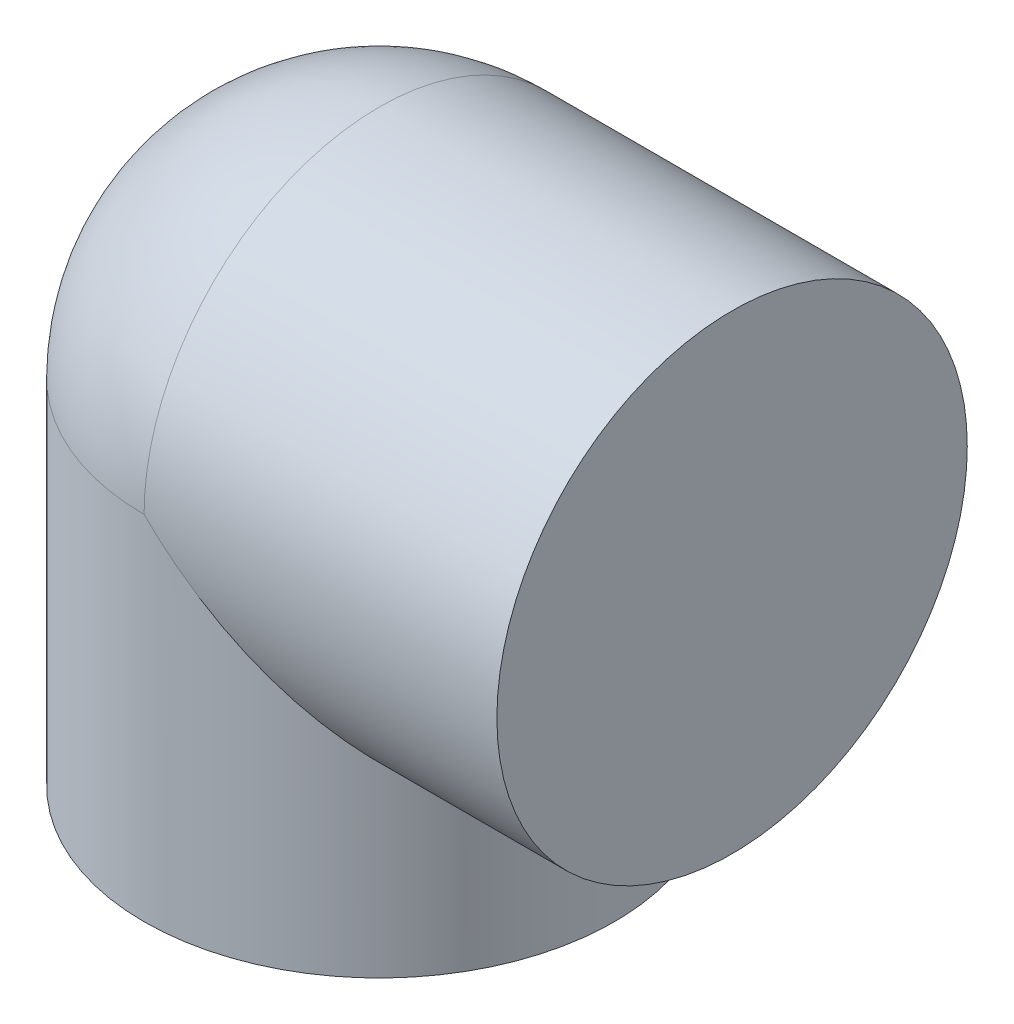
from build123d import *
from build123d.topology import SkipClean

# Parameters (mm, degrees)
BOSS_EXTRUDE3_DEPTH = 50
FILLET1_R           = 20
SKETCH5_R           = 20
BOSS_EXTRUDE4_DEPTH = 30
BOSS_EXTRUDE5_DEPTH = 30


with BuildPart() as part:
    # Sketch4 → Boss-Extrude3 (new body)
    with BuildSketch(Plane(origin=(0, 50, 0), x_dir=(1, 0, 0), z_dir=(0, 1, 0))):
        with BuildLine():
            Line((0, 20), (0, -20))
            ThreePointArc((0, -20), (-20, 0), (0, 20))
        make_face()
    extrude(amount=BOSS_EXTRUDE3_DEPTH)

    # Fillet1
    fillet1_edges = [part.edges().sort_by_distance(p)[0] for p in [
        (-20, 100, 0),
    ]]
    fillet(fillet1_edges, radius=FILLET1_R - 0.0001)  # a hair under: the kernel refuses the full size

    # Sketch5 → Boss-Extrude4 (add)
    with BuildSketch(Plane(origin=(0, 0, 0), x_dir=(0, 0, -1), z_dir=(1, 0, 0))):
        with Locations((0, 80)):
            Circle(SKETCH5_R)
    extrude(amount=BOSS_EXTRUDE4_DEPTH)

    # Sketch6 → Boss-Extrude5 (add)
    with SkipClean():  # the faces are left unmerged after this step: merging them gives an invalid solid
        with BuildSketch(Plane(origin=(0, 50, 0), x_dir=(1, 0, 0), z_dir=(0, 1, 0))):
            with BuildLine():
                Line((0, 20), (0, -20))
                ThreePointArc((0, -20), (20, 0), (0, 20))
            make_face()
        extrude(amount=BOSS_EXTRUDE5_DEPTH)
    add(part.part.scale(1), mode=Mode.REPLACE)  # the faces are merged on a copy


solid = part.part
